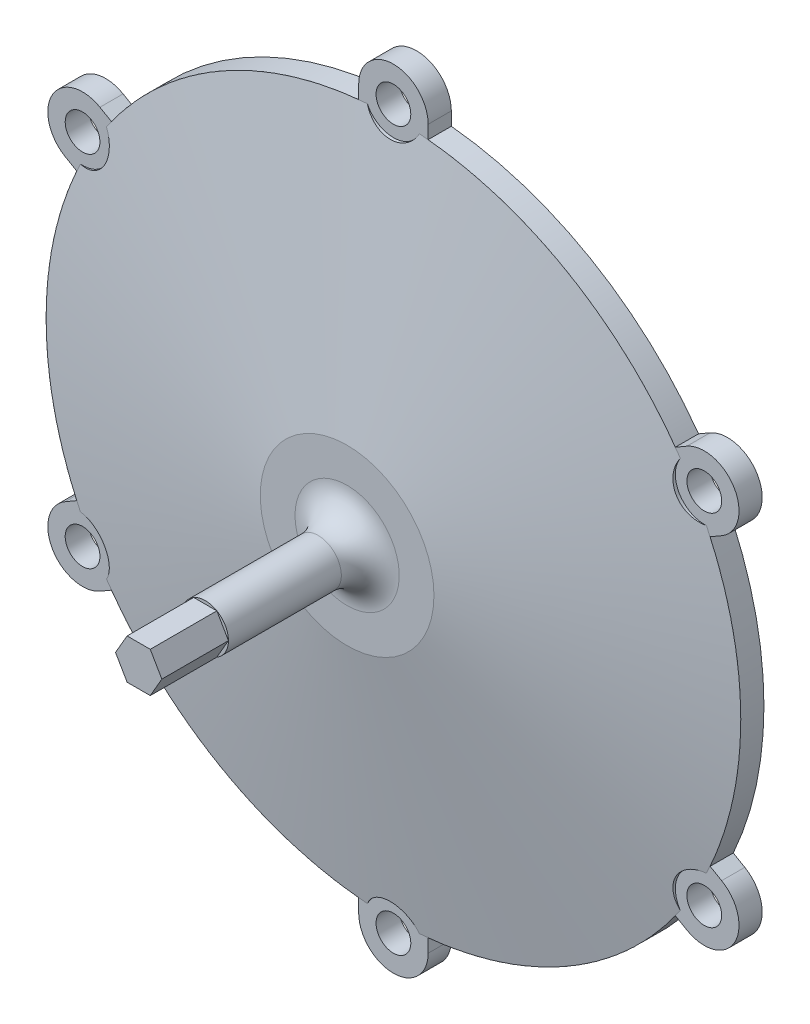
from build123d import *

# Parameters (mm, degrees)
SKETCH1_R           = 57
BOSS_EXTRUDE1_DEPTH = 4
SKETCH4_R           = 14
CUT_EXTRUDE1_DEPTH  = 7
SKETCH9_R           = 11.5
CUT_EXTRUDE4_DEPTH  = 0.5
SKETCH10_R          = 4
BOSS_EXTRUDE2_DEPTH = 36
FILLET1_R           = 5
SKETCH7_R           = 3
CUT_EXTRUDE2_DEPTH  = 101.796825347
SKETCH8_R           = 5
CUT_EXTRUDE3_DEPTH  = 101.796825347
CIRPATTERN6_COUNT   = 6
CUT_EXTRUDE5_DEPTH  = 11.5


with BuildPart() as part:
    # Sketch1 → Boss-Extrude1 (new body)
    with BuildSketch(Plane.XY):
        with BuildLine():
            ThreePointArc((6, 62), (0, 68), (-6, 62))
            Line((-6, 62), (-6, 59.699246226))
            ThreePointArc((-6, 59.699246226), (-30, 51.961524227), (-48.701063819, 35.045775536))
            Line((-48.701063819, 35.045775536), (-50.693575035, 36.196152423))
            ThreePointArc((-50.693575035, 36.196152423), (-58.889727457, 34), (-56.693575035, 25.803847577))
            Line((-56.693575035, 25.803847577), (-54.701063819, 24.65347069))
            ThreePointArc((-54.701063819, 24.65347069), (-60, 0), (-54.701063819, -24.65347069))
            Line((-54.701063819, -24.65347069), (-56.693575035, -25.803847577))
            ThreePointArc((-56.693575035, -25.803847577), (-58.889727457, -34), (-50.693575035, -36.196152423))
            Line((-50.693575035, -36.196152423), (-48.701063819, -35.045775536))
            ThreePointArc((-48.701063819, -35.045775536), (-30, -51.961524227), (-6, -59.699246226))
            Line((-6, -59.699246226), (-6, -62))
            ThreePointArc((-6, -62), (0, -68), (6, -62))
            Line((6, -62), (6, -59.699246226))
            ThreePointArc((6, -59.699246226), (30, -51.961524227), (48.701063819, -35.045775536))
            Line((48.701063819, -35.045775536), (50.693575035, -36.196152423))
            ThreePointArc((50.693575035, -36.196152423), (58.889727457, -34), (56.693575035, -25.803847577))
            Line((56.693575035, -25.803847577), (54.701063819, -24.65347069))
            ThreePointArc((54.701063819, -24.65347069), (60, 0), (54.701063819, 24.65347069))
            Line((54.701063819, 24.65347069), (56.693575035, 25.803847577))
            ThreePointArc((56.693575035, 25.803847577), (58.889727457, 34), (50.693575035, 36.196152423))
            Line((50.693575035, 36.196152423), (48.701063819, 35.045775536))
            ThreePointArc((48.701063819, 35.045775536), (30, 51.961524227), (6, 59.699246226))
            Line((6, 59.699246226), (6, 62))
        make_face()
        Circle(SKETCH1_R, mode=Mode.SUBTRACT)
    extrude(amount=BOSS_EXTRUDE1_DEPTH)

    # Sketch7 → Cut-Extrude2 (cut, through all)
    with BuildSketch(Plane.XY.offset(4)):
        with Locations((0, 62)):
            Circle(SKETCH7_R)
    cut_extrude2 = extrude(amount=-CUT_EXTRUDE2_DEPTH, mode=Mode.SUBTRACT)


with BuildPart() as body_2:
    # Sketch3 → Revolve1 (revolve)
    with BuildSketch(Plane(origin=(0, 0, 0), x_dir=(1, 0, 0), z_dir=(0, 1, 0))):
        Polygon((0, -0.5), (0, -12), (15, -12), (60, -4), (57, -4), (57, -0.5), align=None)
    revolve(axis=Axis((0, 0, 12), (0, 0, -1)))

    # Sketch4 → Cut-Extrude1 (cut)
    with BuildSketch(Plane.XY.offset(0.5)):
        Circle(SKETCH4_R)
    extrude(amount=CUT_EXTRUDE1_DEPTH, mode=Mode.SUBTRACT)

    # Sketch9 → Cut-Extrude4 (cut)
    with BuildSketch(Plane(origin=(0, 0, 7.5), x_dir=(-1, 0, 0), z_dir=(0, 0, -1))):
        Circle(SKETCH9_R)
    extrude(amount=-CUT_EXTRUDE4_DEPTH, mode=Mode.SUBTRACT)

    # Sketch10 → Boss-Extrude2 (add)
    with BuildSketch(Plane.XY.offset(12)):
        Circle(SKETCH10_R)
    extrude(amount=BOSS_EXTRUDE2_DEPTH)

    # Fillet1
    fillet1_edges = [body_2.edges().sort_by_distance(p)[0] for p in [
        (-4, 0, 12),
    ]]
    fillet(fillet1_edges, radius=FILLET1_R)

    # Sketch8 → Cut-Extrude3 (cut, through all)
    with BuildSketch(Plane.XY.offset(4)):
        with Locations((0, 62)):
            Circle(SKETCH8_R)
    cut_extrude3 = extrude(amount=CUT_EXTRUDE3_DEPTH, mode=Mode.SUBTRACT)


with BuildPart() as cirpattern6_tool:
    # CirPattern6: Cut-Extrude2, Cut-Extrude3 ×6 about axis
    cirpattern6_axis = Axis((0, 0, 4), (0, 0, 1))
    add([cut_extrude2.rotate(cirpattern6_axis, i * 360 / CIRPATTERN6_COUNT) for i in range(1, CIRPATTERN6_COUNT)])
    add([cut_extrude3.rotate(cirpattern6_axis, i * 360 / CIRPATTERN6_COUNT) for i in range(1, CIRPATTERN6_COUNT)])


with BuildPart() as part_1:
    add(part.part)

    # CirPattern6: cut by cirpattern6_tool
    add(cirpattern6_tool.part, mode=Mode.SUBTRACT)


with BuildPart() as body_2_1:
    add(body_2.part)

    # CirPattern6: cut by cirpattern6_tool
    add(cirpattern6_tool.part, mode=Mode.SUBTRACT)

    # Sketch11 → Cut-Extrude5 (cut)
    with BuildSketch(Plane.XY.offset(48)):
        with BuildLine():
            ThreePointArc((4, 0), (3.464101615, 2), (2, 3.464101615))
            Line((2, 3.464101615), (4, 0))
        make_face()
        with BuildLine():
            Line((-2, 3.464101615), (2, 3.464101615))
            ThreePointArc((2, 3.464101615), (0, 4), (-2, 3.464101615))
        make_face()
        with BuildLine():
            Line((-4, 0), (-2, 3.464101615))
            ThreePointArc((-2, 3.464101615), (-3.464101615, 2), (-4, 0))
        make_face()
        with BuildLine():
            ThreePointArc((2, -3.464101615), (3.464101615, -2), (4, 0))
            Line((4, 0), (2, -3.464101615))
        make_face()
        with BuildLine():
            Line((-2, -3.464101615), (-4, 0))
            ThreePointArc((-4, 0), (-3.464101615, -2), (-2, -3.464101615))
        make_face()
        with BuildLine():
            ThreePointArc((-2, -3.464101615), (0, -4), (2, -3.464101615))
            Line((2, -3.464101615), (-2, -3.464101615))
        make_face()
    extrude(amount=-CUT_EXTRUDE5_DEPTH, mode=Mode.SUBTRACT)


solid = Compound([part_1.part, body_2_1.part])
